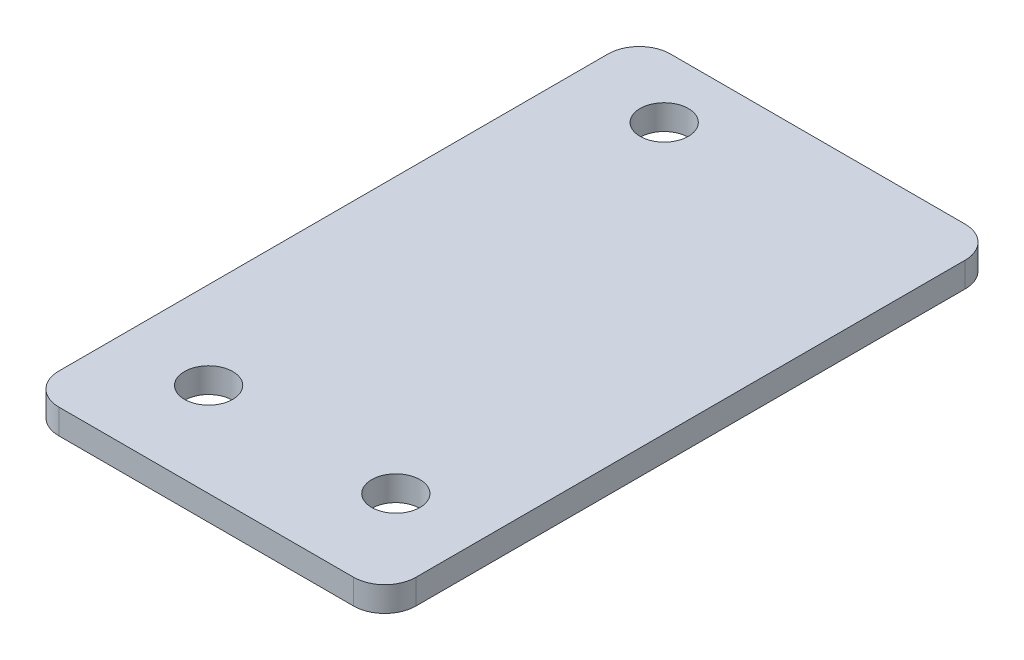
from build123d import *

# Parameters (mm, degrees)
SKETCH1_R           = 2.45745
BOSS_EXTRUDE1_DEPTH = 2.54


with BuildPart() as part:
    # Sketch1 → Boss-Extrude1 (new body)
    with BuildSketch(Plane(origin=(0, 0, 0), x_dir=(1, 0, 0), z_dir=(0, 1, 0))):
        with BuildLine():
            Line((3.175, -4.852667781), (33.16436, -4.852667781))
            ThreePointArc((33.16436, -4.852667781), (35.40942403, -3.922731811), (36.33936, -1.677667781))
            Line((36.33936, -1.677667781), (36.33936, 54.202332219))
            ThreePointArc((36.33936, 54.202332219), (35.40942403, 56.447396249), (33.16436, 57.377332219))
            Line((33.16436, 57.377332219), (3.175, 57.377332219))
            ThreePointArc((3.175, 57.377332219), (0.92993597, 56.447396249), (0, 54.202332219))
            Line((0, 54.202332219), (0, -1.677667781))
            ThreePointArc((0, -1.677667781), (0.92993597, -3.922731811), (3.175, -4.852667781))
        make_face()
        with Locations((8.89, 51.027332219)):
            Circle(SKETCH1_R, mode=Mode.SUBTRACT)
        with Locations((27.94, 4.672332219)):
            Circle(SKETCH1_R, mode=Mode.SUBTRACT)
        with Locations((8.89, 4.672332219)):
            Circle(SKETCH1_R, mode=Mode.SUBTRACT)
    extrude(amount=-BOSS_EXTRUDE1_DEPTH)


solid = part.part
